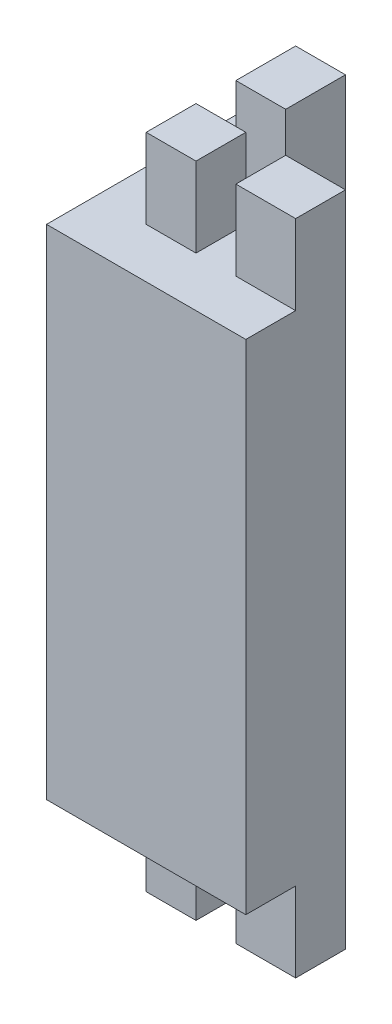
from build123d import *

# Parameters (mm, degrees)
BOSS_EXTRUDE2_DEPTH = 25
SKETCH13_W          = 2.5
SKETCH13_H          = 3
SKETCH13_W_2        = 3
SKETCH13_H_2        = 2.5
BOSS_EXTRUDE3_DEPTH = 4
SKETCH15_W          = 2.5
SKETCH15_H          = 3
SKETCH15_W_2        = 3
SKETCH15_H_2        = 2.5
BOSS_EXTRUDE4_DEPTH = 4


with BuildPart() as part:
    # Sketch12 → Boss-Extrude2 (new body)
    with BuildSketch(Plane(origin=(0, 0, 0), x_dir=(1, 0, 0), z_dir=(0, 1, 0))):
        Polygon((-5, -5), (5, -5), (5, 0), (0, 0), (0, 5), (-5, 5), (-5, 0), align=None)
    extrude(amount=BOSS_EXTRUDE2_DEPTH)

    # Sketch13 → Boss-Extrude3 (add)
    with BuildSketch(Plane(origin=(0, 0, 0), x_dir=(1, 0, 0), z_dir=(0, 1, 0))):
        with Locations((-1.25, 3.5)):
            Rectangle(SKETCH13_W, SKETCH13_H)
        with Locations((3.5, -1.25)):
            Rectangle(SKETCH13_W_2, SKETCH13_H_2)
        with Locations((-1.25, -1.25)):
            Rectangle(SKETCH13_W, SKETCH13_H_2)
    extrude(amount=-BOSS_EXTRUDE3_DEPTH)

    # Sketch15 → Boss-Extrude4 (add)
    with BuildSketch(Plane(origin=(0, 25, 0), x_dir=(1, 0, 0), z_dir=(0, 1, 0))):
        with Locations((-1.25, 3.5)):
            Rectangle(SKETCH15_W, SKETCH15_H)
        with Locations((3.5, -1.25)):
            Rectangle(SKETCH15_W_2, SKETCH15_H_2)
        with Locations((-1.25, -1.25)):
            Rectangle(SKETCH15_W, SKETCH15_H_2)
    extrude(amount=BOSS_EXTRUDE4_DEPTH)


solid = part.part
